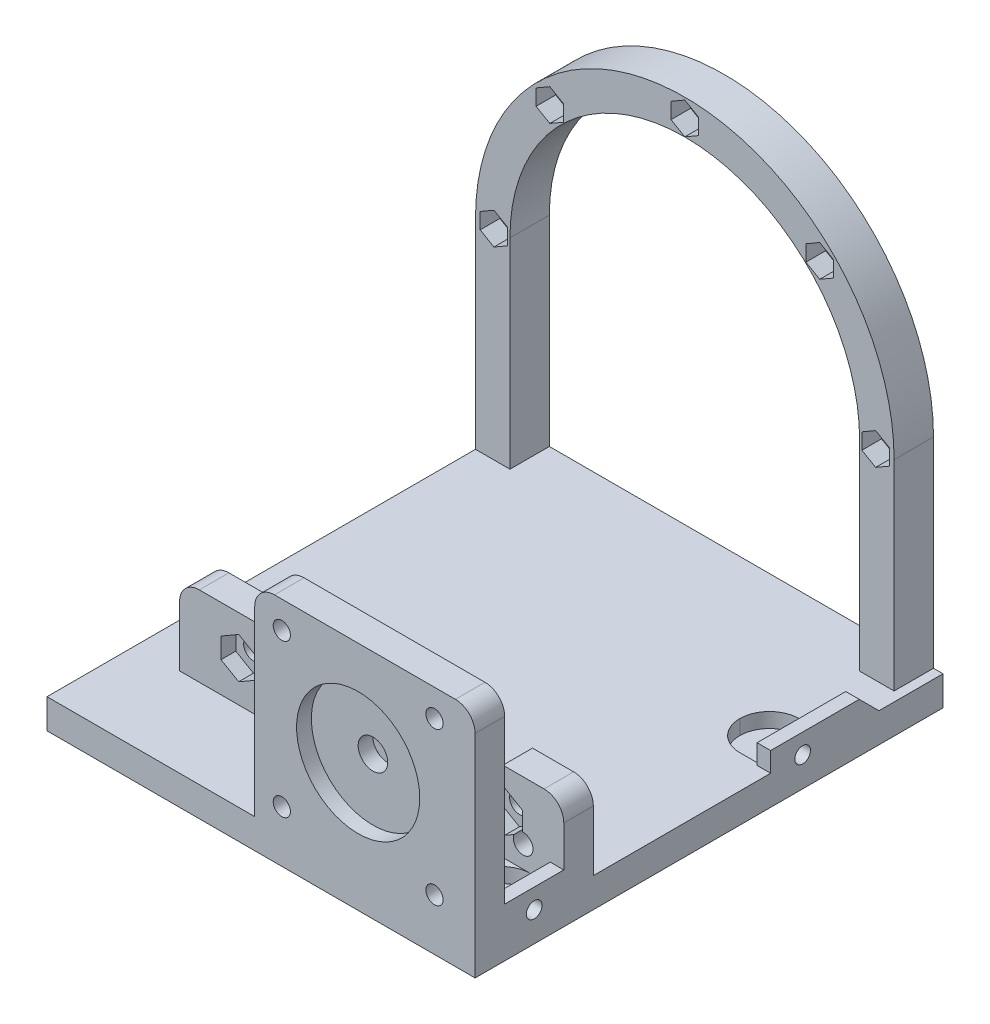
from build123d import *

# Parameters (mm, degrees)
SKETCH1_R            = 18.5
SKETCH1_R_2          = 3.5
SKETCH1_R_3          = 2.25
BOSS_EXTRUDE1_DEPTH  = 6
BOSS_EXTRUDE2_START  = -6
BOSS_EXTRUDE2_DEPTH  = 6
BOSS_EXTRUDE3_DEPTH  = 85
SKETCH6_R            = 2
BOSS_EXTRUDE5_DEPTH  = 6
SKETCH5_W            = 42
SKETCH5_H            = 41
SKETCH5_R            = 1.75
SKETCH5_R_2          = 3
BOSS_EXTRUDE4_DEPTH  = 6
SKETCH8_W            = 25
SKETCH8_H            = 7
BOSS_EXTRUDE7_DEPTH  = 2.75
CHAMFER2_SIZE        = 7
SKETCH9_R            = 1.6
CUT_EXTRUDE2_DEPTH   = 10
SKETCH10_W           = 10
SKETCH10_H           = 12
CUT_EXTRUDE3_DEPTH   = 3
FILLET1_R            = 6
SKETCH13_R           = 2.25
SKETCH13_R_2         = 3.5
CUT_EXTRUDE4_DEPTH   = 10
FILLET2_R            = 4
SKETCH15_W           = 78
SKETCH15_H           = 14
BOSS_EXTRUDE9_DEPTH  = 6
SKETCH17_W           = 85
SKETCH17_H           = 8
BOSS_EXTRUDE10_DEPTH = 86
SKETCH18_W           = 85
SKETCH18_H           = 1
SKETCH18_R           = 35.5
CUT_EXTRUDE8_DEPTH   = 85
BOSS_EXTRUDE11_DEPTH = 6
SKETCH21_R           = 1.7
CUT_EXTRUDE9_DEPTH   = 85
CUT_EXTRUDE10_DEPTH  = 4
CUT_EXTRUDE11_DEPTH  = 3
SKETCH24_R           = 12.5
CUT_EXTRUDE12_DEPTH  = 3


# Some blends are built 0.0001 mm under size
with BuildPart() as part:
    # Sketch1 → Boss-Extrude1 (new body)
    with BuildSketch(Plane.XY):
        Circle(SKETCH1_R)
        Circle(SKETCH1_R_2, mode=Mode.SUBTRACT)
        with Locations((-13.7, 0)):
            Circle(SKETCH1_R_3, mode=Mode.SUBTRACT)
        with Locations((13.7, 0)):
            Circle(SKETCH1_R_3, mode=Mode.SUBTRACT)
    extrude(amount=BOSS_EXTRUDE1_DEPTH)

    # Sketch3 → Boss-Extrude2 (add)
    with BuildSketch(Plane.XY.offset(6).offset(BOSS_EXTRUDE2_START)):
        with BuildLine():
            ThreePointArc((-15.5, -10.099504938), (-17.734147851, -5.267826876), (-18.5, 0))
            Line((-18.5, 0), (-18.5, -46.68))
            Line((-18.5, -46.68), (18.5, -46.68))
            Line((18.5, -46.68), (18.5, 0))
            ThreePointArc((18.5, 0), (17.734147851, -5.267826876), (15.5, -10.099504938))
            Line((15.5, -10.099504938), (15.5, -40.818554828))
            Line((15.5, -40.818554828), (15.5, -43.68))
            Line((15.5, -43.68), (13.738586173, -43.68))
            Line((13.738586173, -43.68), (-13.738586173, -43.68))
            Line((-13.738586173, -43.68), (-15.5, -43.68))
            Line((-15.5, -43.68), (-15.5, -40.818554828))
            Line((-15.5, -40.818554828), (-15.5, -10.099504938))
        make_face()
        with BuildLine():
            Line((-3, -20.512103215), (-15.5, -40.818554828))
            Line((-15.5, -40.818554828), (-15.5, -43.68))
            Line((-15.5, -43.68), (-13.738586173, -43.68))
            Line((-13.738586173, -43.68), (0, -21.361445172))
            Line((0, -21.361445172), (13.738586173, -43.68))
            Line((13.738586173, -43.68), (15.5, -43.68))
            Line((15.5, -43.68), (15.5, -40.818554828))
            Line((15.5, -40.818554828), (3, -20.512103215))
            Line((3, -20.512103215), (1.71251735, -18.420566884))
            ThreePointArc((1.71251735, -18.420566884), (0, -18.5), (-1.71251735, -18.420566884))
            Line((-1.71251735, -18.420566884), (-3, -20.512103215))
        make_face()
        with BuildLine():
            Line((3, -20.512103215), (3, -18.255136264))
            ThreePointArc((3, -18.255136264), (2.357710068, -18.349147207), (1.71251735, -18.420566884))
            Line((1.71251735, -18.420566884), (3, -20.512103215))
        make_face()
        with BuildLine():
            ThreePointArc((-1.71251735, -18.420566884), (-2.357710068, -18.349147207), (-3, -18.255136264))
            Line((-3, -18.255136264), (-3, -20.512103215))
            Line((-3, -20.512103215), (-1.71251735, -18.420566884))
        make_face()
    extrude(amount=BOSS_EXTRUDE2_DEPTH)

    # Sketch4 → Boss-Extrude3 (add)
    with BuildSketch(Plane.XY):
        Polygon((-33.57, -46.68), (-33.57, -40.68), (44.43, -40.68), (44.43, -46.68), (-18.5, -46.68), align=None)
    extrude(amount=BOSS_EXTRUDE3_DEPTH)

    # Sketch6 → Boss-Extrude5 (add)
    with BuildSketch(Plane(origin=(0, 0, 67), x_dir=(-1, 0, 0), z_dir=(0, 0, -1))):
        with BuildLine():
            Line((-44.43, -24.43), (-44.43, -43.68))
            Line((-44.43, -43.68), (33.57, -43.68))
            Line((33.57, -43.68), (33.57, -24.43))
            Line((33.57, -24.43), (-9.280986885, -24.43))
            ThreePointArc((-9.280986885, -24.43), (-20.68, -32.68), (-32.079013115, -24.43))
            Line((-32.079013115, -24.43), (-44.43, -24.43))
        make_face()
        with Locations((-36.18, -36.18)):
            Circle(SKETCH6_R, mode=Mode.SUBTRACT)
        with Locations((-32.43, -32.43)):
            Circle(SKETCH6_R, mode=Mode.SUBTRACT)
        with Locations((-5.18, -36.18)):
            Circle(SKETCH6_R, mode=Mode.SUBTRACT)
        with Locations((21.57, -32.43)):
            Circle(SKETCH6_R, mode=Mode.SUBTRACT)
    extrude(amount=BOSS_EXTRUDE5_DEPTH)

    # Sketch5 → Boss-Extrude4 (add)
    with BuildSketch(Plane.XY.offset(85)):
        with Locations((20.68, -20.18)):
            Rectangle(SKETCH5_W, SKETCH5_H)
        with Locations((5.18, -36.18)):
            Circle(SKETCH5_R, mode=Mode.SUBTRACT)
        with Locations((36.18, -36.18)):
            Circle(SKETCH5_R, mode=Mode.SUBTRACT)
        with Locations((5.18, -5.18)):
            Circle(SKETCH5_R, mode=Mode.SUBTRACT)
        with Locations((20.68, -20.68)):
            Circle(SKETCH5_R_2, mode=Mode.SUBTRACT)
        with Locations((36.18, -5.18)):
            Circle(SKETCH5_R, mode=Mode.SUBTRACT)
    extrude(amount=-BOSS_EXTRUDE4_DEPTH)

    # Sketch8 → Boss-Extrude7 (add)
    with BuildSketch(Plane(origin=(44.43, 0, 0), x_dir=(0, 0, -1), z_dir=(1, 0, 0))):
        with Locations((-12.5, -40.18)):
            Rectangle(SKETCH8_W, SKETCH8_H)
        Polygon((-61, -36.68), (-79, -36.68), (-79, 0.32), (-85, 0.32), (-85, -43.68), (-61, -43.68), align=None)
    extrude(amount=-BOSS_EXTRUDE7_DEPTH)

    # Chamfer2
    # the kernel refuses this chamfer: 7 mm, written as the material it takes off along each edge
    with BuildSketch(Plane(origin=(62.431780916, -36.68, 0), x_dir=(0, 0, 1), z_dir=(-1, 0, 0))) as chamfer2_piece_1:
        Polygon((CHAMFER2_SIZE, 0), (0, -CHAMFER2_SIZE), (0, 0), align=None)
    extrude(amount=38.753561832, mode=Mode.SUBTRACT)
    # the kernel refuses this chamfer: 7 mm, written as the material it takes off along each edge
    with BuildSketch(Plane(origin=(18.5, -40.68, 0), x_dir=(0, -1, 0), z_dir=(1, 0, 0))) as chamfer2_2_piece_1_section:
        Polygon((CHAMFER2_SIZE, 0), (0, -CHAMFER2_SIZE), (0, 0), align=None)
    chamfer2_2_piece_1 = extrude(amount=23.18, mode=Mode.PRIVATE)
    chamfer2_2_piece_1 = split(chamfer2_2_piece_1, bisect_by=Plane(origin=(18.5, -42.18, 1.5), z_dir=(0, 0.7071067811865476, -0.7071067811865476)), keep=Keep.TOP, mode=Mode.PRIVATE)
    add(chamfer2_2_piece_1, mode=Mode.SUBTRACT)

    # Sketch9 → Cut-Extrude2 (cut)
    with BuildSketch(Plane(origin=(44.43, 0, 0), x_dir=(0, 0, -1), z_dir=(1, 0, 0))):
        with Locations((-73, -40.68)):
            Circle(SKETCH9_R)
        with Locations((-18.5, -40.68)):
            Circle(SKETCH9_R)
    extrude(amount=-CUT_EXTRUDE2_DEPTH, mode=Mode.SUBTRACT)

    # Sketch10 → Cut-Extrude3 (cut)
    with BuildSketch(Plane(origin=(0, -40.68, 0), x_dir=(1, 0, 0), z_dir=(0, 1, 0))):
        with Locations((36.68, -18.5)):
            Rectangle(SKETCH10_W, SKETCH10_H)
        with Locations((36.696367594, -73)):
            Rectangle(SKETCH10_W, SKETCH10_H)
    extrude(amount=-CUT_EXTRUDE3_DEPTH, mode=Mode.SUBTRACT)

    # Fillet1
    fillet1_edges = [part.edges().sort_by_distance(p)[0] for p in [
        (31.696367594, -42.18, 67),
        (31.696367594, -42.18, 79),
        (31.68, -42.18, 24.5),
        (31.68, -42.18, 12.5),
    ]]
    fillet(fillet1_edges, radius=FILLET1_R - 0.0001)  # a hair under: the kernel refuses the full size

    # Sketch13 → Cut-Extrude4 (cut)
    # profile 1 of 4: a face of its own
    with BuildSketch(Plane(origin=(0, 0, 0), x_dir=(-1, 0, 0), z_dir=(0, 0, -1))):
        with BuildLine():
            ThreePointArc((3, -18.255136264), (0, -18.5), (-3, -18.255136264))
            Line((-3, -18.255136264), (-3, -20.512103215))
            Line((-3, -20.512103215), (-15.414710094, -40.68))
            Line((-15.414710094, -40.68), (-11.89188244, -40.68))
            Line((-11.89188244, -40.68), (0, -21.361445172))
            Line((0, -21.361445172), (11.89188244, -40.68))
            Line((11.89188244, -40.68), (15.414710094, -40.68))
            Line((15.414710094, -40.68), (3, -20.512103215))
            Line((3, -20.512103215), (3, -18.255136264))
        make_face()
    # profile 2 of 4: a face of its own
    with BuildSketch(Plane(origin=(0, 0, 0), x_dir=(-1, 0, 0), z_dir=(0, 0, -1))):
        with BuildLine():
            ThreePointArc((-15.5, -10.099504938), (-17.734147851, -5.267826876), (-18.5, 0))
            Line((-18.5, 0), (-18.5, -40.68))
            Line((-18.5, -40.68), (-15.5, -40.68))
            Line((-15.5, -40.68), (-15.5, -10.099504938))
        make_face()
    # profile 3 of 4: a face of its own
    with BuildSketch(Plane(origin=(0, 0, 0), x_dir=(-1, 0, 0), z_dir=(0, 0, -1))):
        with BuildLine():
            Line((18.5, -40.68), (18.5, 0))
            ThreePointArc((18.5, 0), (17.734147851, -5.267826876), (15.5, -10.099504938))
            Line((15.5, -10.099504938), (15.5, -40.68))
            Line((15.5, -40.68), (18.5, -40.68))
        make_face()
    # profile 4 of 4: a face of its own
    with BuildSketch(Plane(origin=(0, 0, 0), x_dir=(-1, 0, 0), z_dir=(0, 0, -1))):
        with BuildLine():
            ThreePointArc((18.5, 0), (0, 18.5), (-18.5, 0))
            ThreePointArc((-18.5, 0), (-17.734147851, -5.267826876), (-15.5, -10.099504938))
            ThreePointArc((-15.5, -10.099504938), (-10.10896041, -15.493834884), (-3, -18.255136264))
            ThreePointArc((-3, -18.255136264), (0, -18.5), (3, -18.255136264))
            ThreePointArc((3, -18.255136264), (10.10896041, -15.493834884), (15.5, -10.099504938))
            ThreePointArc((15.5, -10.099504938), (17.734147851, -5.267826876), (18.5, 0))
        make_face()
        with Locations((-13.7, 0)):
            Circle(SKETCH13_R, mode=Mode.SUBTRACT)
        Circle(SKETCH13_R_2, mode=Mode.SUBTRACT)
        with Locations((13.7, 0)):
            Circle(SKETCH13_R, mode=Mode.SUBTRACT)
    extrude(amount=-CUT_EXTRUDE4_DEPTH, mode=Mode.SUBTRACT)

    # Fillet2
    fillet2_edges = [part.edges().sort_by_distance(p)[0] for p in [
        (44.43, -24.43, 64),
        (-33.57, -24.43, 64),
        (-0.32, 0.32, 82),
        (44.43, 0.32, 82),
        (-33.57, -43.68, 0),
        (-33.57, -43.68, 85),
    ]]
    fillet(fillet2_edges, radius=FILLET2_R)

    # Sketch15 → Boss-Extrude9 (add)
    with BuildSketch(Plane(origin=(0, -40.68, 0), x_dir=(1, 0, 0), z_dir=(0, 1, 0))):
        with Locations((5.43, 3)):
            Rectangle(SKETCH15_W, SKETCH15_H)
    extrude(amount=-BOSS_EXTRUDE9_DEPTH)

    # Sketch17 → Boss-Extrude10 (add)
    with BuildSketch(Plane(origin=(0, -40.68, 0), x_dir=(1, 0, 0), z_dir=(0, 1, 0))):
        with Locations((0, 6)):
            Rectangle(SKETCH17_W, SKETCH17_H)
    extrude(amount=BOSS_EXTRUDE10_DEPTH)

    # Sketch18 → Cut-Extrude8 (cut)
    with BuildSketch(Plane(origin=(0, 0, -2), x_dir=(-1, 0, 0), z_dir=(0, 0, -1))):
        with BuildLine():
            ThreePointArc((-42.5, -1.19e-07), (-5.9e-08, 42.5), (42.5, 0))
            Line((42.5, 0), (42.5, 2.32))
            Line((42.5, 2.32), (42.5, 44.32))
            Line((42.5, 44.32), (-42.5, 44.32))
            Line((-42.5, 44.32), (-42.5, -1.19e-07))
        make_face()
        with Locations((0, 44.82)):
            Rectangle(SKETCH18_W, SKETCH18_H)
        Circle(SKETCH18_R)
        with BuildLine():
            Line((35.5, -23.366642891), (35.5, 0))
            ThreePointArc((35.5, 0), (0, -35.5), (-35.5, 0))
            Line((-35.5, 0), (-35.5, -23.366642891))
            ThreePointArc((-35.5, -23.366642891), (-25.421307893, -34.058877037), (-12.30396684, -40.68))
            Line((-12.30396684, -40.68), (12.30396684, -40.68))
            ThreePointArc((12.30396684, -40.68), (25.421307893, -34.058877037), (35.5, -23.366642891))
        make_face()
        with BuildLine():
            Line((35.5, -40.68), (35.5, -23.366642891))
            ThreePointArc((35.5, -23.366642891), (25.421307893, -34.058877037), (12.30396684, -40.68))
            Line((12.30396684, -40.68), (33.57, -40.68))
            Line((33.57, -40.68), (35.5, -40.68))
        make_face()
        with BuildLine():
            ThreePointArc((-12.30396684, -40.68), (-25.421307893, -34.058877037), (-35.5, -23.366642891))
            Line((-35.5, -23.366642891), (-35.5, -40.68))
            Line((-35.5, -40.68), (-12.30396684, -40.68))
        make_face()
    extrude(amount=CUT_EXTRUDE8_DEPTH, mode=Mode.SUBTRACT)

    # Sketch19 → Boss-Extrude11 (add)
    with BuildSketch(Plane.XZ.offset(46.68)):
        Polygon((-33.57, -10), (-42.5, -10), (-42.5, 85), (-18.104719374, 85), align=None)
    extrude(amount=-BOSS_EXTRUDE11_DEPTH)

    # Sketch21 → Cut-Extrude9 (cut)
    with BuildSketch(Plane.XY.offset(-2)):
        with Locations((-38.75, 0)):
            Circle(SKETCH21_R)
        with Locations((-27.400387771, 27.400387771)):
            Circle(SKETCH21_R)
        with Locations((0, 38.75)):
            Circle(SKETCH21_R)
        with Locations((27.400387771, 27.400387771)):
            Circle(SKETCH21_R)
        with Locations((38.75, 0)):
            Circle(SKETCH21_R)
    extrude(amount=-CUT_EXTRUDE9_DEPTH, mode=Mode.SUBTRACT)

    # Sketch22 → Cut-Extrude10 (cut)
    with BuildSketch(Plane.XY.offset(-2)):
        Polygon((38.75, 3.233161507), (35.95, 1.616580754), (35.95, -1.616580754), (38.75, -3.233161507), (41.55, -1.616580754), (41.55, 1.616580754), align=None)
        Polygon((27.400387771, 30.633549278), (24.600387771, 29.016968525), (24.600387771, 25.783807017), (27.400387771, 24.167226264), (30.200387771, 25.783807017), (30.200387771, 29.016968525), align=None)
        Polygon((0, 41.983161507), (-2.8, 40.366580754), (-2.8, 37.133419246), (0, 35.516838493), (2.8, 37.133419246), (2.8, 40.366580754), align=None)
        Polygon((-27.400387771, 30.633549278), (-30.200387771, 29.016968525), (-30.200387771, 25.783807017), (-27.400387771, 24.167226264), (-24.600387771, 25.783807017), (-24.600387771, 29.016968525), align=None)
        Polygon((-38.75, 3.233161507), (-41.55, 1.616580754), (-41.55, -1.616580754), (-38.75, -3.233161507), (-35.95, -1.616580754), (-35.95, 1.616580754), align=None)
    extrude(amount=-CUT_EXTRUDE10_DEPTH, mode=Mode.SUBTRACT)

    # Sketch23 → Cut-Extrude11 (cut)
    with BuildSketch(Plane.XY.offset(67)):
        Polygon((-21.57, -28.273078062), (-25.17, -30.351539031), (-25.17, -34.508460969), (-21.57, -36.586921938), (-17.97, -34.508460969), (-17.97, -30.351539031), align=None)
        Polygon((32.43, -28.273078062), (28.83, -30.351539031), (28.83, -34.508460969), (32.43, -36.586921938), (36.03, -34.508460969), (36.03, -30.351539031), align=None)
    extrude(amount=-CUT_EXTRUDE11_DEPTH, mode=Mode.SUBTRACT)

    # Sketch24 → Cut-Extrude12 (cut)
    with BuildSketch(Plane.XY.offset(85)):
        with Locations((20.68, -20.68)):
            Circle(SKETCH24_R)
    extrude(amount=-CUT_EXTRUDE12_DEPTH, mode=Mode.SUBTRACT)


solid = part.part
